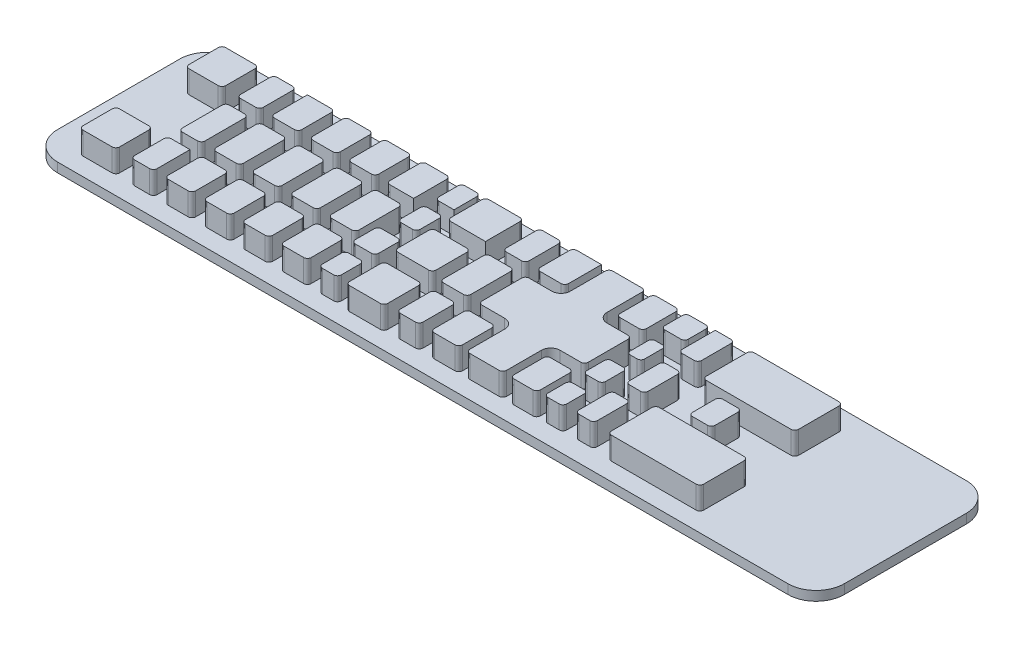
from build123d import *

# Parameters (mm, degrees)
SKETCH1_W           = 215.9
SKETCH1_H           = 50.8
BOSS_EXTRUDE1_DEPTH = 2.54
SKETCH5_W           = 9.906
SKETCH5_H           = 9.906
SKETCH5_W_2         = 6.096
SKETCH5_H_2         = 12.7
SKETCH5_W_3         = 7.366
SKETCH5_W_4         = 5.08
SKETCH5_H_3         = 7.112
SKETCH5_W_5         = 6.35
SKETCH5_W_6         = 10.287
SKETCH5_H_4         = 10.287
SKETCH5_W_7         = 7.62
SKETCH5_W_8         = 7.112
SKETCH5_H_5         = 6.731
SKETCH5_W_9         = 5.0038
SKETCH5_W_10        = 3.81
SKETCH5_W_11        = 5.230116989
SKETCH5_H_6         = 8.1534
SKETCH5_W_12        = 24.9174
SKETCH5_H_7         = 12.954
BOSS_EXTRUDE4_DEPTH = 6.096
FILLET10_R          = 1.016
FILLET11_R          = 1.016
SKETCH6_W           = 215.9
SKETCH6_H           = 1.27
CUT_EXTRUDE1_DEPTH  = 2.54
SKETCH7_W           = 1.905
SKETCH7_H           = 48.26
SKETCH7_W_2         = 1.27
CUT_EXTRUDE2_DEPTH  = 2.54
FILLET13_R          = 7.62


with BuildPart() as part:
    # Sketch1 → Boss-Extrude1 (new body)
    with BuildSketch(Plane(origin=(0, 0, 0), x_dir=(1, 0, 0), z_dir=(0, 1, 0))):
        Rectangle(SKETCH1_W, SKETCH1_H)
    extrude(amount=BOSS_EXTRUDE1_DEPTH)

    # Sketch5 → Boss-Extrude4 (add)
    with BuildSketch(Plane(origin=(0, 2.54, 0), x_dir=(1, 0, 0), z_dir=(0, 1, 0))):
        with BuildLine():
            Line((6.604, 19.304), (6.604, 8.89))
            ThreePointArc((6.604, 8.89), (5.860051224, 7.093948776), (4.064, 6.35))
            Line((4.064, 6.35), (-3.048, 6.35))
            Line((-3.048, 6.35), (-3.048, -6.35))
            Line((-3.048, -6.35), (4.064, -6.35))
            ThreePointArc((4.064, -6.35), (5.860051224, -7.093948776), (6.604, -8.89))
            Line((6.604, -8.89), (6.604, -19.304))
            Line((6.604, -19.304), (16.51, -19.304))
            Line((16.51, -19.304), (16.51, -8.89))
            ThreePointArc((16.51, -8.89), (17.253948776, -7.093948776), (19.05, -6.35))
            Line((19.05, -6.35), (25.654, -6.35))
            Line((25.654, -6.35), (25.654, 6.35))
            Line((25.654, 6.35), (19.05, 6.35))
            ThreePointArc((19.05, 6.35), (17.253948776, 7.093948776), (16.51, 8.89))
            Line((16.51, 8.89), (16.51, 19.304))
            Line((16.51, 19.304), (6.604, 19.304))
        make_face()
        with Locations((-93.091, 14.351)):
            Rectangle(SKETCH5_W, SKETCH5_H)
        with Locations((-93.091, -14.351)):
            Rectangle(SKETCH5_W, SKETCH5_H)
        with Locations((-81.026, -14.351)):
            Rectangle(SKETCH5_W_2, SKETCH5_H)
        with Locations((-81.026, 0)):
            Rectangle(SKETCH5_W_2, SKETCH5_H_2)
        with Locations((-81.026, 14.351)):
            Rectangle(SKETCH5_W_2, SKETCH5_H)
        with Locations((-71.247, 14.351)):
            Rectangle(SKETCH5_W_3, SKETCH5_H)
        with Locations((-71.247, 0)):
            Rectangle(SKETCH5_W_3, SKETCH5_H_2)
        with Locations((-71.247, -14.351)):
            Rectangle(SKETCH5_W_3, SKETCH5_H)
        with Locations((-60.833, -14.351)):
            Rectangle(SKETCH5_W_3, SKETCH5_H)
        with Locations((-60.833, 0)):
            Rectangle(SKETCH5_W_3, SKETCH5_H_2)
        with Locations((-60.833, 14.351)):
            Rectangle(SKETCH5_W_3, SKETCH5_H)
        with Locations((-50.419, 14.351)):
            Rectangle(SKETCH5_W_3, SKETCH5_H)
        with Locations((-50.419, 0)):
            Rectangle(SKETCH5_W_3, SKETCH5_H_2)
        with Locations((-50.419, -14.351)):
            Rectangle(SKETCH5_W_3, SKETCH5_H)
        with Locations((-40.005, -14.351)):
            Rectangle(SKETCH5_W_3, SKETCH5_H)
        with Locations((-40.005, 0)):
            Rectangle(SKETCH5_W_3, SKETCH5_H_2)
        with Locations((-40.005, 14.351)):
            Rectangle(SKETCH5_W_3, SKETCH5_H)
        with Locations((-30.734, 15.748)):
            Rectangle(SKETCH5_W_4, SKETCH5_H_3)
        with Locations((-30.734, 5.588)):
            Rectangle(SKETCH5_W_4, SKETCH5_H_3)
        with Locations((-31.369, -5.588)):
            Rectangle(SKETCH5_W_5, SKETCH5_H_3)
        with Locations((-21.6535, -0.1905)):
            Rectangle(SKETCH5_W_6, SKETCH5_H_4)
        with Locations((-21.6535, 14.1605)):
            Rectangle(SKETCH5_W_6, SKETCH5_H_4)
        with Locations((-9.144, 14.351)):
            Rectangle(SKETCH5_W_2, SKETCH5_H)
        with Locations((0.762, 14.351)):
            Rectangle(SKETCH5_W_7, SKETCH5_H)
        with Locations((-9.779, 0)):
            Rectangle(SKETCH5_W_3, SKETCH5_H_2)
        with Locations((-30.734, -15.748)):
            Rectangle(SKETCH5_W_4, SKETCH5_H_3)
        with Locations((-20.3835, -14.5415)):
            Rectangle(SKETCH5_W_6, SKETCH5_H_4)
        with Locations((-9.144, -14.351)):
            Rectangle(SKETCH5_W_2, SKETCH5_H)
        with Locations((0.762, -14.351)):
            Rectangle(SKETCH5_W_7, SKETCH5_H)
        with Locations((22.098, -14.351)):
            Rectangle(SKETCH5_W_8, SKETCH5_H)
        with Locations((29.972, -15.6845)):
            Rectangle(SKETCH5_W_4, SKETCH5_H_5)
        with Locations((38.0619, -13.843)):
            Rectangle(SKETCH5_W_9, SKETCH5_H)
        with Locations((29.972, -5.1435)):
            Rectangle(SKETCH5_W_4, SKETCH5_H_5)
        with Locations((30.607, 5.3975)):
            Rectangle(SKETCH5_W_10, SKETCH5_H_5)
        with Locations((30.607, 15.9385)):
            Rectangle(SKETCH5_W_5, SKETCH5_H_5)
        with Locations((22.098, 14.351)):
            Rectangle(SKETCH5_W_8, SKETCH5_H)
        with Locations((37.948741506, 14.351)):
            Rectangle(SKETCH5_W_11, SKETCH5_H)
        with Locations((38.0619, -0.127)):
            Rectangle(SKETCH5_W_9, SKETCH5_H)
        with Locations((54.5338, 0.092583228)):
            Rectangle(SKETCH5_W_2, SKETCH5_H_6)
        with Locations((57.3405, -12.827)):
            Rectangle(SKETCH5_W_12, SKETCH5_H_7)
        with Locations((57.3405, 12.827)):
            Rectangle(SKETCH5_W_12, SKETCH5_H_7)
    extrude(amount=BOSS_EXTRUDE4_DEPTH)

    # Fillet10
    fillet10_edges = [part.edges().sort_by_distance(p)[0] for p in [
        (40.5638, 5.588, -4.826),
        (32.512, 5.588, -8.763),
        (33.782, 5.588, -19.304),
        (40.5638, 5.588, -19.304),
        (18.542, 5.588, -19.304),
        (25.654, 5.588, -19.304),
        (27.432, 5.588, -19.304),
        (28.702, 5.588, -8.763),
        (27.432, 5.588, 1.778),
        (27.432, 5.588, 12.319),
        (25.654, 5.588, 9.398),
        (33.782, 5.588, -12.573),
        (32.512, 5.588, -2.032),
        (32.512, 5.588, 1.778),
        (32.512, 5.588, 12.319),
        (32.512, 5.588, 8.509),
        (25.654, 5.588, 19.304),
        (18.542, 5.588, 19.304),
        (18.542, 5.588, 9.398),
        (18.542, 5.588, -9.398),
        (25.654, 5.588, -9.398),
        (27.432, 5.588, -12.573),
        (28.702, 5.588, -2.032),
        (27.432, 5.588, 8.509),
        (27.432, 5.588, 19.05),
        (32.512, 5.588, 19.05),
        (35.56, 5.588, -4.826),
        (40.5638, 5.588, -9.398),
        (35.333683011, 5.588, -9.398),
        (35.56, 5.588, 5.08),
        (35.56, 5.588, 8.89),
        (35.56, 5.588, 18.796),
        (40.5638, 5.588, 18.796),
        (40.5638, 5.588, 5.08),
        (40.5638, 5.588, 8.89),
        (44.8818, 5.588, -6.35),
        (44.8818, 5.588, -19.304),
        (69.7992, 5.588, -19.304),
        (69.7992, 5.588, -6.35),
        (57.5818, 5.588, -4.169283228),
        (51.4858, 5.588, -4.169283228),
        (57.5818, 5.588, 3.984116772),
        (51.4858, 5.588, 3.984116772),
        (44.8818, 5.588, 6.35),
        (44.8818, 5.588, 19.304),
        (69.7992, 5.588, 6.35),
        (69.7992, 5.588, 19.304),
    ]]
    fillet(fillet10_edges, radius=FILLET10_R)

    # Fillet11
    fillet11_edges = [part.edges().sort_by_distance(p)[0] for p in [
        (-88.138, 5.588, -9.398),
        (-88.138, 5.588, 9.398),
        (-98.044, 5.588, -9.398),
        (-98.044, 5.588, -19.304),
        (-88.138, 5.588, -19.304),
        (-84.074, 5.588, -19.304),
        (-77.978, 5.588, -6.35),
        (-67.564, 5.588, -6.35),
        (-64.516, 5.588, -19.304),
        (-77.978, 5.588, -19.304),
        (-67.564, 5.588, -19.304),
        (-57.15, 5.588, -9.398),
        (-57.15, 5.588, -6.35),
        (-34.544, 5.588, 9.144),
        (-57.15, 5.588, 6.35),
        (-46.736, 5.588, 6.35),
        (-67.564, 5.588, 9.398),
        (-67.564, 5.588, 6.35),
        (-64.516, 5.588, 6.35),
        (-67.564, 5.588, -9.398),
        (-64.516, 5.588, -9.398),
        (-64.516, 5.588, -6.35),
        (-74.93, 5.588, -6.35),
        (-74.93, 5.588, -9.398),
        (-77.978, 5.588, -9.398),
        (-84.074, 5.588, -9.398),
        (-84.074, 5.588, -6.35),
        (-84.074, 5.588, 6.35),
        (-77.978, 5.588, 6.35),
        (-74.93, 5.588, 6.35),
        (-74.93, 5.588, 9.398),
        (-67.564, 5.588, 19.304),
        (-74.93, 5.588, 19.304),
        (-77.978, 5.588, 19.304),
        (-88.138, 5.588, 19.304),
        (-84.074, 5.588, 19.304),
        (-84.074, 5.588, 9.398),
        (-98.044, 5.588, 9.398),
        (-98.044, 5.588, 19.304),
        (-54.102, 5.588, 6.35),
        (-54.102, 5.588, -6.35),
        (-54.102, 5.588, -9.398),
        (-33.274, 5.588, -12.192),
        (-43.688, 5.588, -9.398),
        (-43.688, 5.588, 6.35),
        (4.572, 5.588, -9.398),
        (-28.194, 5.588, -2.032),
        (4.572, 5.588, 9.398),
        (-6.096, 5.588, -9.398),
        (-6.096, 5.588, -6.35),
        (-46.736, 5.588, -9.398),
        (-54.102, 5.588, -19.304),
        (-57.15, 5.588, -19.304),
        (-46.736, 5.588, -19.304),
        (-46.736, 5.588, -6.35),
        (-36.322, 5.588, 9.398),
        (-33.274, 5.588, 19.304),
        (-43.688, 5.588, 19.304),
        (-64.516, 5.588, 19.304),
        (-64.516, 5.588, 9.398),
        (-57.15, 5.588, 9.398),
        (-54.102, 5.588, 9.398),
        (-46.736, 5.588, 9.398),
        (-43.688, 5.588, 9.398),
        (-33.274, 5.588, -2.032),
        (-28.194, 5.588, 2.032),
        (-34.544, 5.588, 2.032),
        (-33.274, 5.588, 12.192),
        (-25.527, 5.588, 9.398),
        (-3.048, 5.588, 9.398),
        (-12.192, 5.588, 9.398),
        (-26.797, 5.588, -4.953),
        (-16.51, 5.588, -4.953),
        (-13.462, 5.588, -6.35),
        (-12.192, 5.588, -9.398),
        (-26.797, 5.588, -9.017),
        (-28.194, 5.588, -9.144),
        (-33.274, 5.588, -9.144),
        (-36.322, 5.588, -6.35),
        (-43.688, 5.588, -6.35),
        (-43.688, 5.588, -19.304),
        (-36.322, 5.588, -19.304),
        (-33.274, 5.588, -19.304),
        (-28.194, 5.588, -19.304),
        (-26.797, 5.588, -19.304),
        (-16.51, 5.588, -19.304),
        (-12.192, 5.588, -19.304),
        (-6.096, 5.588, -19.304),
        (16.51, 5.588, -19.304),
        (6.604, 5.588, -19.304),
        (-3.048, 5.588, -19.304),
        (-3.048, 5.588, -9.398),
        (-3.048, 5.588, -6.35),
        (-15.24, 5.588, 9.398),
        (-6.096, 5.588, 9.398),
        (-3.048, 5.588, 6.35),
        (-6.096, 5.588, 6.35),
        (-13.462, 5.588, 6.35),
        (-16.51, 5.588, 5.334),
        (-26.797, 5.588, 5.334),
        (-28.194, 5.588, 12.192),
        (-28.194, 5.588, 9.144),
        (-36.322, 5.588, 6.35),
        (-57.15, 5.588, 19.304),
        (-54.102, 5.588, 19.304),
        (-46.736, 5.588, 19.304),
        (-36.322, 5.588, 19.304),
        (-28.194, 5.588, 19.304),
        (-25.527, 5.588, 19.685),
        (-15.24, 5.588, 19.685),
        (-12.192, 5.588, 19.304),
        (-6.096, 5.588, 19.304),
        (-3.048, 5.588, 19.304),
        (4.572, 5.588, 19.304),
        (6.604, 5.588, 19.304),
        (16.51, 5.588, 19.304),
        (25.654, 5.588, -6.35),
        (25.654, 5.588, 6.35),
    ]]
    fillet(fillet11_edges, radius=FILLET11_R)

    # Sketch6 → Cut-Extrude1 (cut)
    with BuildSketch(Plane(origin=(0, 2.54, 0), x_dir=(1, 0, 0), z_dir=(0, 1, 0))):
        with Locations((0, -24.765)):
            Rectangle(SKETCH6_W, SKETCH6_H)
        with Locations((0, 24.765)):
            Rectangle(SKETCH6_W, SKETCH6_H)
    extrude(amount=-CUT_EXTRUDE1_DEPTH, mode=Mode.SUBTRACT)

    # Sketch7 → Cut-Extrude2 (cut)
    with BuildSketch(Plane(origin=(0, 2.54, 0), x_dir=(1, 0, 0), z_dir=(0, 1, 0))):
        with Locations((106.9975, 0)):
            Rectangle(SKETCH7_W, SKETCH7_H)
        with Locations((-107.315, 0)):
            Rectangle(SKETCH7_W_2, SKETCH7_H)
    extrude(amount=-CUT_EXTRUDE2_DEPTH, mode=Mode.SUBTRACT)

    # Fillet13
    fillet13_edges = [part.edges().sort_by_distance(p)[0] for p in [
        (-106.68, 1.27, 24.13),
        (-106.68, 1.27, -24.13),
        (106.045, 1.27, -24.13),
        (106.045, 1.27, 24.13),
    ]]
    fillet(fillet13_edges, radius=FILLET13_R)


solid = part.part
